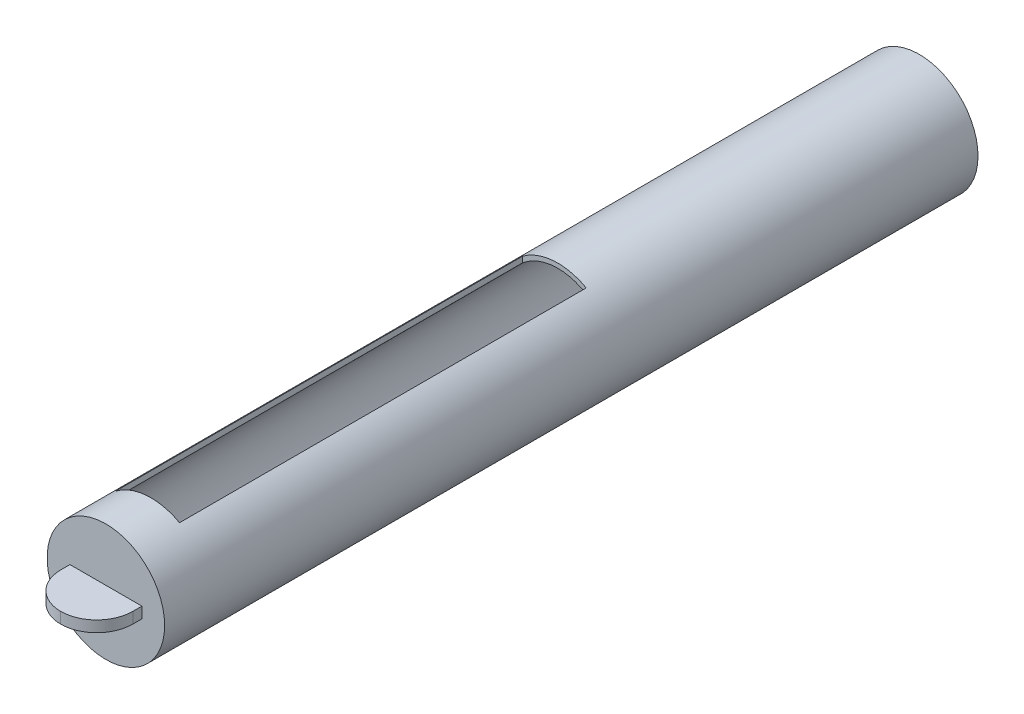
from build123d import *

# Parameters (mm, degrees)
BOSS_EXTRUDE1_DEPTH      = 12.7
BOSS_EXTRUDE1_DEPTH_BACK = 215.9
SKETCH1_R                = 16.51
SHELL1_T                 = 1.27
SKETCH2_W                = 17.94421574
SKETCH2_H                = 13.769076435
CUT_EXTRUDE1_DEPTH       = 114.3
SKETCH3_W                = 20.21918521
SKETCH3_H                = 3.109812076
BOSS_EXTRUDE2_DEPTH      = 12.7
FILLET1_R                = 10.16


with BuildPart() as part:
    # Sketch1 → Boss-Extrude1 (new, two sides: drawn at the far end of the back side and taken through both)
    with BuildSketch(Plane.XY.offset(-BOSS_EXTRUDE1_DEPTH_BACK)):
        with Locations((0, -25.4)):
            Circle(SKETCH1_R)
    extrude(amount=BOSS_EXTRUDE1_DEPTH + BOSS_EXTRUDE1_DEPTH_BACK)

    # Shell1 (no face opened: a closed hollow body)
    add(offset(amount=-SHELL1_T, mode=Mode.PRIVATE), mode=Mode.SUBTRACT)

    # Sketch2 → Cut-Extrude1 (cut)
    with BuildSketch(Plane.XY):
        with Locations((-0.977160263, -11.097927059)):
            Rectangle(SKETCH2_W, SKETCH2_H)
    extrude(amount=-CUT_EXTRUDE1_DEPTH, mode=Mode.SUBTRACT)

    # Sketch3 → Boss-Extrude2 (add)
    with BuildSketch(Plane.XY.offset(12.7)):
        with Locations((0, -25.4)):
            Rectangle(SKETCH3_W, SKETCH3_H)
    extrude(amount=BOSS_EXTRUDE2_DEPTH)

    # Fillet1
    # the kernel refuses this fillet: 10.16 mm, written as the material it takes off along each edge
    with BuildSketch(Plane(origin=(10.109592605, -52.354906038, 25.4), x_dir=(0, 0, -1), z_dir=(0, 1, 0)), Plane(origin=(-10.109592605, 1.554906038, 25.4), x_dir=(0, 0, -1), z_dir=(0, -1, 0))) as fillet1_piece_1:
        with BuildLine():
            CenterArc((FILLET1_R, FILLET1_R), FILLET1_R, 180, 90)
            Line((0, FILLET1_R), (0, 0))
            Line((0, 0), (FILLET1_R, 0))
        make_face()
    extrude(amount=53.909812076, mode=Mode.SUBTRACT)


solid = part.part
